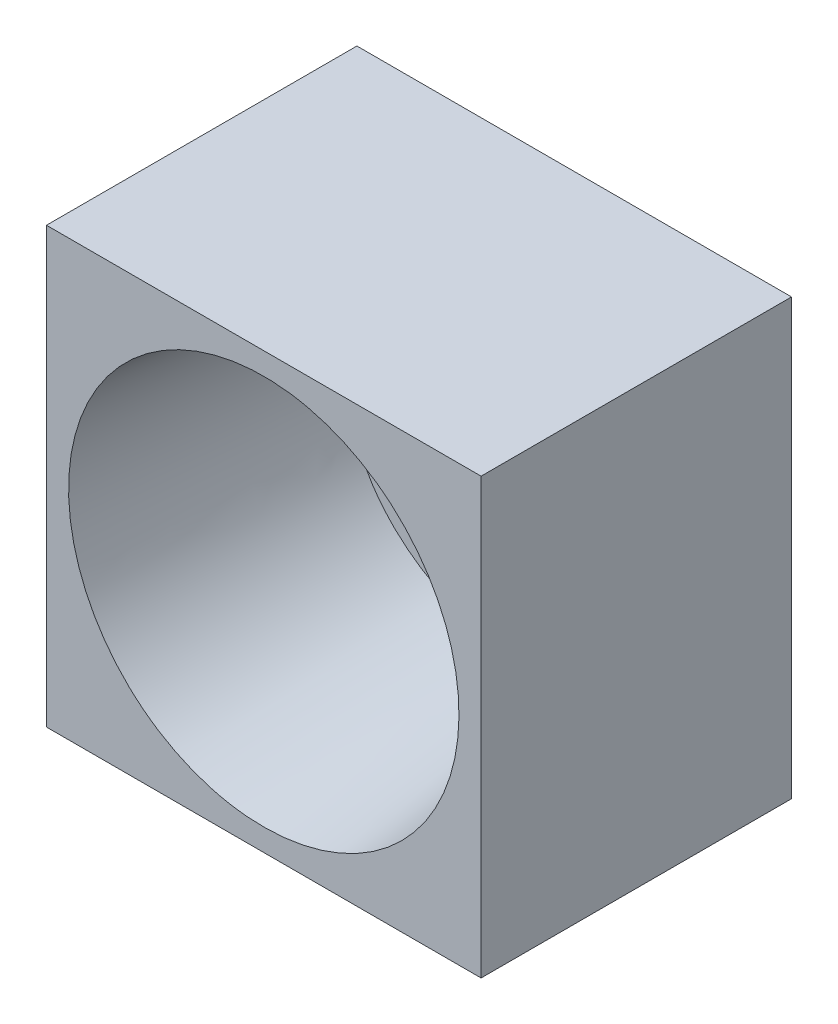
from build123d import *

# Parameters (mm, degrees)
SKETCH1_W           = 70
SKETCH1_H           = 70
BOSS_EXTRUDE1_DEPTH = 50
SKETCH8_R           = 2.5
CUT_EXTRUDE1_DEPTH  = 50


with BuildPart() as part:
    # Sketch1 → Boss-Extrude1 (new body)
    with BuildSketch(Plane.XY):
        with Locations((-35, -35)):
            Rectangle(SKETCH1_W, SKETCH1_H)
    extrude(amount=BOSS_EXTRUDE1_DEPTH)

    # Cut-Loft1: read off the stored shape, not the designer's step
    # Cut-Loft1: loft between two sections, ruled curve by curve
    cut_loft1_from = [
        Edge.make_bspline([(-19.308746069, -13.027641226, 10), (-63.253463616, 18.354866636, 10), (-94.635971478, -25.589850912, 10), (-50.691253931, -56.972358774, 10), (-6.746536384, -88.354866636, 10), (24.635971478, -44.410149088, 10), (-19.308746069, -13.027641226, 10)], [0, 0, 0, 0, 0.5, 0.5, 0.5, 1, 1, 1, 1], 3, [1, 0.333333333, 0.333333333, 1, 0.333333333, 0.333333333, 1]),
    ]
    cut_loft1_to = [
        Edge.make_bspline([(-22.079724584, -6.336756909, 50), (-79.406210767, 19.503793923, 50), (-105.246761599, -37.82269226, 50), (-47.920275416, -63.663243091, 50), (9.406210767, -89.503793923, 50), (35.246761599, -32.17730774, 50), (-22.079724584, -6.336756909, 50)], [0, 0, 0, 0, 0.5, 0.5, 0.5, 1, 1, 1, 1], 3, [1, 0.333333333, 0.333333333, 1, 0.333333333, 0.333333333, 1]),
    ]
    cut_loft1 = Solid(Shell([*[Face.make_surface_from_curves(cut_loft1_from[k], cut_loft1_to[k]) for k in range(1)], Face(Wire(cut_loft1_from)), Face(Wire(cut_loft1_to))]))
    add(cut_loft1, mode=Mode.SUBTRACT)

    # Sketch8 → Cut-Extrude1 (cut)
    with BuildSketch(Plane.XY.offset(10)):
        with Locations((-27.5, -35)):
            Circle(SKETCH8_R)
        with Locations(Location((-42.5, -35, 0), (0, 0, 180))):
            Circle(SKETCH8_R)
    extrude(amount=-CUT_EXTRUDE1_DEPTH, mode=Mode.SUBTRACT)


solid = part.part
